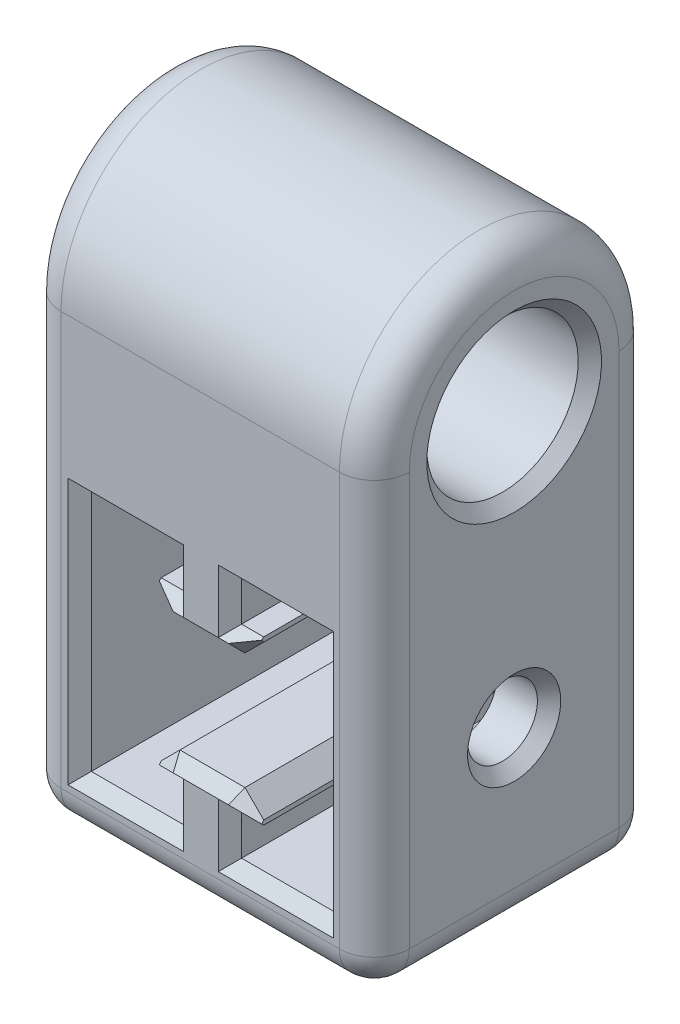
from build123d import *

# Parameters (mm, degrees)
BOSS_EXTRUDE1_DEPTH = 24
SKETCH5_R           = 6.5
BOSS_EXTRUDE3_DEPTH = 29.899298
SKETCH3_R           = 3
CUT_EXTRUDE1_DEPTH  = 53.251488462
SKETCH6_R           = 12
SKETCH6_R_2         = 5
BOSS_EXTRUDE4_DEPTH = 4
FILLET1_R           = 3
CHAMFER1_SIZE       = 1


with BuildPart() as part:
    # Sketch1 → Boss-Extrude1 (new body)
    with BuildSketch(Plane.XY):
        Polygon((0, 15), (14.899298428, 15), (14.899298428, -14.949649214), (-15, -14.949649214), (-15, 15), align=None)
        Polygon((-10.4, 10.4), (-2.5, 10.4), (-2.5, 7), (-4.4, 7), (-4.4, 6.61), (-2.79, 5), (2.79, 5), (4.4, 6.61), (4.4, 7), (2.5, 7), (2.5, 10.4), (10.4, 10.4), (10.4, 2.933567191), (10.4, -2.933567191), (10.4, -10.4), (2.5, -10.4), (2.5, -7), (4.4, -7), (4.4, -6.61), (2.79, -5), (-2.79, -5), (-4.4, -6.61), (-4.4, -7), (-2.5, -7), (-2.5, -10.4), (-10.4, -10.4), (-10.4, -2.933567191), (-10.4, -2.61), (-10.4, 2.933567191), align=None, mode=Mode.SUBTRACT)
    extrude(amount=BOSS_EXTRUDE1_DEPTH)

    # Sketch5 → Boss-Extrude3 (add, through all)
    with BuildSketch(Plane.ZY.offset(15)):
        with BuildLine():
            Line((0, 15), (24, 15))
            Line((24, 15), (24, 23.5))
            ThreePointArc((24, 23.5), (12, 35.5), (0, 23.5))
            Line((0, 23.5), (0, 15))
        make_face()
        with Locations((12, 23.5)):
            Circle(SKETCH5_R, mode=Mode.SUBTRACT)
    extrude(amount=-BOSS_EXTRUDE3_DEPTH)

    # Sketch3 → Cut-Extrude1 (cut, through all)
    with BuildSketch(Plane.ZY.offset(15)):
        with Locations((12, 0)):
            Circle(SKETCH3_R)
    extrude(amount=-CUT_EXTRUDE1_DEPTH, mode=Mode.SUBTRACT)

    # Sketch6 → Boss-Extrude4 (add)
    with BuildSketch(Plane.ZY.offset(15)):
        with Locations((12, 23.5)):
            Circle(SKETCH6_R)
        with Locations((12, 23.5)):
            Circle(SKETCH6_R_2, mode=Mode.SUBTRACT)
    extrude(amount=-BOSS_EXTRUDE4_DEPTH)

    # Fillet1
    fillet1_edges = [part.edges().sort_by_distance(p)[0] for p in [
        (-0.050350786, -14.949649214, 24),
        (14.899298428, 0.025175393, 24),
        (14.899298428, 0.025175393, 0),
        (-0.050350786, -14.949649214, 0),
        (-15, 4.275175393, 0),
        (-15, 4.275175393, 24),
        (14.899298428, -14.949649214, 12),
        (-15, -14.949649214, 12),
        (14.899298, 35.5, 12),
        (-15, 35.5, 12),
    ]]
    fillet(fillet1_edges, radius=FILLET1_R)

    # Chamfer1
    # the kernel refuses this chamfer: 1 mm, written as the material it takes off along each edge
    with BuildSketch(Plane(origin=(-15, 0, 12), x_dir=(0, 0, 1), z_dir=(0, -1, 0))) as chamfer1_piece_1:
        Polygon((3 + CHAMFER1_SIZE, 0), (3, -CHAMFER1_SIZE), (3, 0), align=None)
    revolve(axis=Axis((-15, 0, 12), (-1, 0, 0)), mode=Mode.SUBTRACT)
    with BuildSketch(Plane(origin=(14.899298428, 0, 12), x_dir=(0, 0, 1), z_dir=(0, -1, 0))) as chamfer1_piece_2:
        Polygon((3 + CHAMFER1_SIZE, 0), (3, CHAMFER1_SIZE), (3, 0), align=None)
    revolve(axis=Axis((14.899298428, 0, 12), (-1, 0, 0)), mode=Mode.SUBTRACT)
    with BuildSketch(Plane(origin=(14.899298, 23.5, 12), x_dir=(0, 0, 1), z_dir=(0, -1, 0))) as chamfer1_piece_3:
        Polygon((6.5 + CHAMFER1_SIZE, 0), (6.5, CHAMFER1_SIZE), (6.5, 0), align=None)
    revolve(axis=Axis((14.899298, 23.5, 12), (-1, 0, 0)), mode=Mode.SUBTRACT)
    with BuildSketch(Plane(origin=(-6.21845448, 8.42845448, 0), x_dir=(-0.019442520806012883, -0.01944252080601297, 0.9996219169112968), z_dir=(0.7071067811865491, -0.707106781186546, 0)), Plane(origin=(0.97154552, 3.18154552, 0), x_dir=(0.01944252080601412, -0.019442520806014222, 0.9996219169112968), z_dir=(0.7071067811865493, 0.7071067811865458, 0)), Plane(origin=(6.21845448, -8.42845448, 0), x_dir=(0.019442520806013733, 0.019442520806013854, 0.9996219169112968), z_dir=(-0.7071067811865498, 0.7071067811865452, 0)), Plane(origin=(-0.97154552, -3.18154552, 0), x_dir=(-0.019442520806014107, 0.019442520806014236, 0.9996219169112968), z_dir=(-0.7071067811865498, -0.7071067811865452, 0)), Plane(origin=(-0.97154552, -3.18154552, 24), x_dir=(0.7068394360706712, -0.7068394360706757, 0.02749587661058563), z_dir=(-0.7071067811865498, -0.7071067811865452, 0)), Plane(origin=(6.21845448, -8.42845448, 24), x_dir=(-0.7068394360706712, -0.7068394360706758, 0.027495876610585647), z_dir=(-0.7071067811865498, 0.7071067811865452, 0)), Plane(origin=(0.97154552, 3.18154552, 24), x_dir=(-0.7068394360706717, 0.7068394360706753, 0.02749587661058563), z_dir=(0.7071067811865493, 0.7071067811865458, 0)), Plane(origin=(-6.21845448, 8.42845448, 24), x_dir=(0.706839436070672, 0.706839436070675, 0.02749587661058563), z_dir=(0.7071067811865491, -0.707106781186546, 0))) as chamfer1_piece_4:
        Polygon((CHAMFER1_SIZE * 0.999621916911, -CHAMFER1_SIZE * 0.0274958766106), (-CHAMFER1_SIZE * 0.0274958766106, -CHAMFER1_SIZE * 0.999621916911), (0, 0), align=None)
    extrude(amount=7.420249811, mode=Mode.SUBTRACT)
    with BuildSketch(Plane(origin=(-5.361682988, 5, 0), x_dir=(0, -0.027495876610586494, 0.9996219169112968), z_dir=(1, 0, 0)), Plane(origin=(5.361682988, -5, 0), x_dir=(0, 0.027495876610586494, 0.9996219169112968), z_dir=(-1, 0, 0)), Plane(origin=(5.361682988, -5, 24), x_dir=(0, -0.9996219169112968, 0.027495876610585623), z_dir=(-1, 0, 0)), Plane(origin=(-5.361682988, 5, 24), x_dir=(0, 0.9996219169112968, 0.027495876610585623), z_dir=(1, 0, 0))) as chamfer1_piece_5:
        Polygon((CHAMFER1_SIZE * 0.999621916911, -CHAMFER1_SIZE * 0.0274958766106), (-CHAMFER1_SIZE * 0.0274958766106, -CHAMFER1_SIZE * 0.999621916911), (0, 0), align=None)
    extrude(amount=10.723365976, mode=Mode.SUBTRACT)
    with BuildSketch(Plane(origin=(6.971682988, 7, 0), x_dir=(0, 0.027495876610586494, 0.9996219169112968), z_dir=(-1, 0, 0)), Plane(origin=(2.5, -7, 0), x_dir=(0, -0.027495876610586494, 0.9996219169112968), z_dir=(1, 0, 0)), Plane(origin=(-6.971682988, -7, 0), x_dir=(0, -0.027495876610586494, 0.9996219169112968), z_dir=(1, 0, 0)), Plane(origin=(-2.5, 7, 0), x_dir=(0, 0.027495876610586494, 0.9996219169112968), z_dir=(-1, 0, 0)), Plane(origin=(-6.971682988, -7, 24), x_dir=(1.4018567596735031e-15, 0.9996219169112968, 0.027495876610585623), z_dir=(1, 0, 0)), Plane(origin=(2.5, -7, 24), x_dir=(-1.4018567596735031e-15, 0.9996219169112968, 0.027495876610585623), z_dir=(1, 0, 0)), Plane(origin=(6.971682988, 7, 24), x_dir=(0, -0.9996219169112968, 0.027495876610585623), z_dir=(-1, 0, 0)), Plane(origin=(-2.5, 7, 24), x_dir=(0, -0.9996219169112968, 0.027495876610585623), z_dir=(-1, 0, 0))) as chamfer1_piece_6:
        Polygon((CHAMFER1_SIZE * 0.999621916911, -CHAMFER1_SIZE * 0.0274958766106), (-CHAMFER1_SIZE * 0.0274958766106, -CHAMFER1_SIZE * 0.999621916911), (0, 0), align=None)
    extrude(amount=4.471682988, mode=Mode.SUBTRACT)
    with BuildSketch(Plane(origin=(2.5, 7, 0), x_dir=(0.027495876610586494, 0, 0.9996219169112968), z_dir=(0, 1, 0)), Plane(origin=(2.5, -10.4, 0), x_dir=(0.027495876610586494, 0, 0.9996219169112968), z_dir=(0, 1, 0)), Plane(origin=(-2.5, -7, 0), x_dir=(-0.027495876610586494, 0, 0.9996219169112968), z_dir=(0, -1, 0)), Plane(origin=(-2.5, 10.4, 0), x_dir=(-0.027495876610586494, 0, 0.9996219169112968), z_dir=(0, -1, 0)), Plane(origin=(-2.5, 10.4, 24), x_dir=(0.9996219169112968, 1.5145550481962746e-14, 0.02749587661058563), z_dir=(0, -1, 0)), Plane(origin=(-2.5, -7, 24), x_dir=(0.9996219169112968, 1.488442030123925e-14, 0.02749587661058563), z_dir=(0, -1, 0)), Plane(origin=(2.5, -10.4, 24), x_dir=(-0.9996219169112968, 1.488442030123925e-14, 0.02749587661058563), z_dir=(0, 1, 0)), Plane(origin=(2.5, 7, 24), x_dir=(-0.9996219169112968, -1.5145550481962746e-14, 0.02749587661058563), z_dir=(0, 1, 0))) as chamfer1_piece_7:
        Polygon((CHAMFER1_SIZE * 0.999621916911, -CHAMFER1_SIZE * 0.0274958766106), (-CHAMFER1_SIZE * 0.0274958766106, -CHAMFER1_SIZE * 0.999621916911), (0, 0), align=None)
    extrude(amount=3.4, mode=Mode.SUBTRACT)
    with BuildSketch(Plane(origin=(2.5, 10.4, 0), x_dir=(0, -0.02749587661058563, 0.9996219169112968), z_dir=(1, 0, 0)), Plane(origin=(10.4, -10.4, 0), x_dir=(0, 0.02749587661058563, 0.9996219169112968), z_dir=(-1, 0, 0)), Plane(origin=(-2.5, -10.4, 0), x_dir=(0, 0.02749587661058563, 0.9996219169112968), z_dir=(-1, 0, 0)), Plane(origin=(-10.4, 10.4, 0), x_dir=(0, -0.02749587661058563, 0.9996219169112968), z_dir=(1, 0, 0)), Plane(origin=(-10.4, 10.4, 24), x_dir=(0, 0.9996219169112968, 0.027495876610585647), z_dir=(1, 0, 0)), Plane(origin=(-2.5, -10.4, 24), x_dir=(0, -0.9996219169112968, 0.027495876610585647), z_dir=(-1, 0, 0)), Plane(origin=(10.4, -10.4, 24), x_dir=(0, -0.9996219169112968, 0.027495876610585647), z_dir=(-1, 0, 0)), Plane(origin=(2.5, 10.4, 24), x_dir=(0, 0.9996219169112968, 0.027495876610585647), z_dir=(1, 0, 0))) as chamfer1_piece_8:
        Polygon((CHAMFER1_SIZE * 0.999621916911, -CHAMFER1_SIZE * 0.0274958766106), (-CHAMFER1_SIZE * 0.0274958766106, -CHAMFER1_SIZE * 0.999621916911), (0, 0), align=None)
    extrude(amount=7.9, mode=Mode.SUBTRACT)
    with BuildSketch(Plane(origin=(10.4, 10.4, 0), x_dir=(-0.02749587661058908, 0, 0.9996219169112968), z_dir=(0, -1, 0)), Plane(origin=(-10.4, -10.4, 0), x_dir=(0.027495876610587354, 0, 0.9996219169112968), z_dir=(0, 1, 0))) as chamfer1_piece_9:
        Polygon((CHAMFER1_SIZE * 0.999621916911, -CHAMFER1_SIZE * 0.0274958766106), (-CHAMFER1_SIZE * 0.0274958766106, -CHAMFER1_SIZE * 0.999621916911), (0, 0), align=None)
    extrude(amount=20.8, mode=Mode.SUBTRACT)
    with BuildSketch(Plane(origin=(-10.4, 10.4, 24), x_dir=(-0.9996219169112968, 0, 0.027495876610585647), z_dir=(0, -1, 0)), Plane(origin=(10.4, -10.4, 24), x_dir=(0.9996219169112968, 0, 0.027495876610585647), z_dir=(0, 1, 0))) as chamfer1_piece_10:
        Polygon((CHAMFER1_SIZE * 0.999621916911, CHAMFER1_SIZE * 0.0274958766106), (-CHAMFER1_SIZE * 0.0274958766106, CHAMFER1_SIZE * 0.999621916911), (0, 0), align=None)
    extrude(amount=20.8, mode=Mode.SUBTRACT)
    with BuildSketch(Plane(origin=(-15, 23.5, 12), x_dir=(0, 0, 1), z_dir=(0, -1, 0))) as chamfer1_piece_11:
        Polygon((5 + CHAMFER1_SIZE, 0), (5, -CHAMFER1_SIZE), (5, 0), align=None)
    revolve(axis=Axis((-15, 23.5, 12), (-1, 0, 0)), mode=Mode.SUBTRACT)
    with BuildSketch(Plane(origin=(2.5, 4.428317012, 0), x_dir=(0.027495876610586494, 0, 0.9996219169112968), z_dir=(0, 1, 0))) as chamfer1_piece_12a_section:
        Polygon((CHAMFER1_SIZE * 0.999621916911, -CHAMFER1_SIZE * 0.0274958766106), (-CHAMFER1_SIZE * 0.0274958766106, -CHAMFER1_SIZE * 0.999621916911), (0, 0), align=None)
    chamfer1_piece_12a = extrude(amount=5.971682988, mode=Mode.PRIVATE)
    chamfer1_piece_12a = split(chamfer1_piece_12a, bisect_by=Plane(origin=(2.170206373, 7, 0.329793627), z_dir=(0, -1, 0)), keep=Keep.TOP, mode=Mode.PRIVATE)
    with BuildSketch(Plane(origin=(6.971682988, 7, 0), x_dir=(0, 0.027495876610586494, 0.9996219169112968), z_dir=(-1, 0, 0))) as chamfer1_piece_12b_section:
        Polygon((CHAMFER1_SIZE * 0.999621916911, -CHAMFER1_SIZE * 0.0274958766106), (-CHAMFER1_SIZE * 0.0274958766106, -CHAMFER1_SIZE * 0.999621916911), (0, 0), align=None)
    chamfer1_piece_12b = extrude(amount=7.043365976, mode=Mode.PRIVATE)
    chamfer1_piece_12b = split(chamfer1_piece_12b, bisect_by=Plane(origin=(2.5, 6.670206373, 0.329793627), z_dir=(-1, 0, 0)), keep=Keep.TOP, mode=Mode.PRIVATE)
    chamfer1_piece_12 = chamfer1_piece_12a & chamfer1_piece_12b
    add(chamfer1_piece_12, mode=Mode.SUBTRACT)
    with BuildSketch(Plane(origin=(-0.071682988, 10.4, 0), x_dir=(0, -0.02749587661058563, 0.9996219169112968), z_dir=(1, 0, 0))) as chamfer1_piece_13a_section:
        Polygon((CHAMFER1_SIZE * 0.999621916911, -CHAMFER1_SIZE * 0.0274958766106), (-CHAMFER1_SIZE * 0.0274958766106, -CHAMFER1_SIZE * 0.999621916911), (0, 0), align=None)
    chamfer1_piece_13a = extrude(amount=10.471682988, mode=Mode.PRIVATE)
    chamfer1_piece_13a = split(chamfer1_piece_13a, bisect_by=Plane(origin=(2.5, 10.729793627, 0.329793627), z_dir=(-1, 0, 0)), keep=Keep.TOP, mode=Mode.PRIVATE)
    with BuildSketch(Plane(origin=(2.5, 7, 0), x_dir=(0.027495876610586494, 0, 0.9996219169112968), z_dir=(0, 1, 0))) as chamfer1_piece_13b_section:
        Polygon((CHAMFER1_SIZE * 0.999621916911, -CHAMFER1_SIZE * 0.0274958766106), (-CHAMFER1_SIZE * 0.0274958766106, -CHAMFER1_SIZE * 0.999621916911), (0, 0), align=None)
    chamfer1_piece_13b = extrude(amount=5.971682988, mode=Mode.PRIVATE)
    chamfer1_piece_13b = split(chamfer1_piece_13b, bisect_by=Plane(origin=(2.170206373, 10.4, 0.329793627), z_dir=(0, 1, 0)), keep=Keep.TOP, mode=Mode.PRIVATE)
    chamfer1_piece_13 = chamfer1_piece_13a & chamfer1_piece_13b
    add(chamfer1_piece_13, mode=Mode.SUBTRACT)
    with BuildSketch(Plane(origin=(10.4, 12.971682988, 0), x_dir=(-0.02749587661058563, 0, 0.9996219169112968), z_dir=(0, -1, 0))) as chamfer1_piece_14a_section:
        Polygon((CHAMFER1_SIZE * 0.999621916911, -CHAMFER1_SIZE * 0.0274958766106), (-CHAMFER1_SIZE * 0.0274958766106, -CHAMFER1_SIZE * 0.999621916911), (0, 0), align=None)
    chamfer1_piece_14a = extrude(amount=23.371682988, mode=Mode.PRIVATE)
    chamfer1_piece_14a = split(chamfer1_piece_14a, bisect_by=Plane(origin=(10.729793627, 10.4, 0.329793627), z_dir=(0, 1, 0)), keep=Keep.TOP, mode=Mode.PRIVATE)
    with BuildSketch(Plane(origin=(2.5, 10.4, 0), x_dir=(0, -0.02749587661058563, 0.9996219169112968), z_dir=(1, 0, 0))) as chamfer1_piece_14b_section:
        Polygon((CHAMFER1_SIZE * 0.999621916911, -CHAMFER1_SIZE * 0.0274958766106), (-CHAMFER1_SIZE * 0.0274958766106, -CHAMFER1_SIZE * 0.999621916911), (0, 0), align=None)
    chamfer1_piece_14b = extrude(amount=10.471682988, mode=Mode.PRIVATE)
    chamfer1_piece_14b = split(chamfer1_piece_14b, bisect_by=Plane(origin=(10.4, 10.729793627, 0.329793627), z_dir=(1, 0, 0)), keep=Keep.TOP, mode=Mode.PRIVATE)
    chamfer1_piece_14 = chamfer1_piece_14a & chamfer1_piece_14b
    add(chamfer1_piece_14, mode=Mode.SUBTRACT)
    with BuildSketch(Plane(origin=(12.971682988, -10.4, 0), x_dir=(0, 0.02749587661058563, 0.9996219169112968), z_dir=(-1, 0, 0))) as chamfer1_piece_15a_section:
        Polygon((CHAMFER1_SIZE * 0.999621916911, -CHAMFER1_SIZE * 0.0274958766106), (-CHAMFER1_SIZE * 0.0274958766106, -CHAMFER1_SIZE * 0.999621916911), (0, 0), align=None)
    chamfer1_piece_15a = extrude(amount=10.471682988, mode=Mode.PRIVATE)
    chamfer1_piece_15a = split(chamfer1_piece_15a, bisect_by=Plane(origin=(10.4, -10.729793627, 0.329793627), z_dir=(1, 0, 0)), keep=Keep.TOP, mode=Mode.PRIVATE)
    with BuildSketch(Plane(origin=(10.4, 10.4, 0), x_dir=(-0.02749587661058908, 0, 0.9996219169112968), z_dir=(0, -1, 0))) as chamfer1_piece_15b_section:
        Polygon((CHAMFER1_SIZE * 0.999621916911, -CHAMFER1_SIZE * 0.0274958766106), (-CHAMFER1_SIZE * 0.0274958766106, -CHAMFER1_SIZE * 0.999621916911), (0, 0), align=None)
    chamfer1_piece_15b = extrude(amount=23.371682988, mode=Mode.PRIVATE)
    chamfer1_piece_15b = split(chamfer1_piece_15b, bisect_by=Plane(origin=(10.729793627, -10.4, 0.329793627), z_dir=(0, -1, 0)), keep=Keep.TOP, mode=Mode.PRIVATE)
    chamfer1_piece_15 = chamfer1_piece_15a & chamfer1_piece_15b
    add(chamfer1_piece_15, mode=Mode.SUBTRACT)
    with BuildSketch(Plane(origin=(2.5, -12.971682988, 0), x_dir=(0.027495876610586494, 0, 0.9996219169112968), z_dir=(0, 1, 0))) as chamfer1_piece_16a_section:
        Polygon((CHAMFER1_SIZE * 0.999621916911, -CHAMFER1_SIZE * 0.0274958766106), (-CHAMFER1_SIZE * 0.0274958766106, -CHAMFER1_SIZE * 0.999621916911), (0, 0), align=None)
    chamfer1_piece_16a = extrude(amount=5.971682988, mode=Mode.PRIVATE)
    chamfer1_piece_16a = split(chamfer1_piece_16a, bisect_by=Plane(origin=(2.170206373, -10.4, 0.329793627), z_dir=(0, -1, 0)), keep=Keep.TOP, mode=Mode.PRIVATE)
    with BuildSketch(Plane(origin=(10.4, -10.4, 0), x_dir=(0, 0.02749587661058563, 0.9996219169112968), z_dir=(-1, 0, 0))) as chamfer1_piece_16b_section:
        Polygon((CHAMFER1_SIZE * 0.999621916911, -CHAMFER1_SIZE * 0.0274958766106), (-CHAMFER1_SIZE * 0.0274958766106, -CHAMFER1_SIZE * 0.999621916911), (0, 0), align=None)
    chamfer1_piece_16b = extrude(amount=10.471682988, mode=Mode.PRIVATE)
    chamfer1_piece_16b = split(chamfer1_piece_16b, bisect_by=Plane(origin=(2.5, -10.729793627, 0.329793627), z_dir=(-1, 0, 0)), keep=Keep.TOP, mode=Mode.PRIVATE)
    chamfer1_piece_16 = chamfer1_piece_16a & chamfer1_piece_16b
    add(chamfer1_piece_16, mode=Mode.SUBTRACT)
    with BuildSketch(Plane(origin=(-0.071682988, -7, 0), x_dir=(0, -0.027495876610586494, 0.9996219169112968), z_dir=(1, 0, 0))) as chamfer1_piece_17a_section:
        Polygon((CHAMFER1_SIZE * 0.999621916911, -CHAMFER1_SIZE * 0.0274958766106), (-CHAMFER1_SIZE * 0.0274958766106, -CHAMFER1_SIZE * 0.999621916911), (0, 0), align=None)
    chamfer1_piece_17a = extrude(amount=7.043365976, mode=Mode.PRIVATE)
    chamfer1_piece_17a = split(chamfer1_piece_17a, bisect_by=Plane(origin=(2.5, -6.670206373, 0.329793627), z_dir=(-1, 0, 0)), keep=Keep.TOP, mode=Mode.PRIVATE)
    with BuildSketch(Plane(origin=(2.5, -10.4, 0), x_dir=(0.027495876610586494, 0, 0.9996219169112968), z_dir=(0, 1, 0))) as chamfer1_piece_17b_section:
        Polygon((CHAMFER1_SIZE * 0.999621916911, -CHAMFER1_SIZE * 0.0274958766106), (-CHAMFER1_SIZE * 0.0274958766106, -CHAMFER1_SIZE * 0.999621916911), (0, 0), align=None)
    chamfer1_piece_17b = extrude(amount=5.971682988, mode=Mode.PRIVATE)
    chamfer1_piece_17b = split(chamfer1_piece_17b, bisect_by=Plane(origin=(2.170206373, -7, 0.329793627), z_dir=(0, 1, 0)), keep=Keep.TOP, mode=Mode.PRIVATE)
    chamfer1_piece_17 = chamfer1_piece_17a & chamfer1_piece_17b
    add(chamfer1_piece_17, mode=Mode.SUBTRACT)
    with BuildSketch(Plane(origin=(-2.5, -4.428317012, 0), x_dir=(-0.027495876610586494, 0, 0.9996219169112968), z_dir=(0, -1, 0))) as chamfer1_piece_18a_section:
        Polygon((CHAMFER1_SIZE * 0.999621916911, -CHAMFER1_SIZE * 0.0274958766106), (-CHAMFER1_SIZE * 0.0274958766106, -CHAMFER1_SIZE * 0.999621916911), (0, 0), align=None)
    chamfer1_piece_18a = extrude(amount=5.971682988, mode=Mode.PRIVATE)
    chamfer1_piece_18a = split(chamfer1_piece_18a, bisect_by=Plane(origin=(-2.170206373, -7, 0.329793627), z_dir=(0, 1, 0)), keep=Keep.TOP, mode=Mode.PRIVATE)
    with BuildSketch(Plane(origin=(-6.971682988, -7, 0), x_dir=(0, -0.027495876610586494, 0.9996219169112968), z_dir=(1, 0, 0))) as chamfer1_piece_18b_section:
        Polygon((CHAMFER1_SIZE * 0.999621916911, -CHAMFER1_SIZE * 0.0274958766106), (-CHAMFER1_SIZE * 0.0274958766106, -CHAMFER1_SIZE * 0.999621916911), (0, 0), align=None)
    chamfer1_piece_18b = extrude(amount=7.043365976, mode=Mode.PRIVATE)
    chamfer1_piece_18b = split(chamfer1_piece_18b, bisect_by=Plane(origin=(-2.5, -6.670206373, 0.329793627), z_dir=(1, 0, 0)), keep=Keep.TOP, mode=Mode.PRIVATE)
    chamfer1_piece_18 = chamfer1_piece_18a & chamfer1_piece_18b
    add(chamfer1_piece_18, mode=Mode.SUBTRACT)
    with BuildSketch(Plane(origin=(0.071682988, -10.4, 0), x_dir=(0, 0.02749587661058563, 0.9996219169112968), z_dir=(-1, 0, 0))) as chamfer1_piece_19a_section:
        Polygon((CHAMFER1_SIZE * 0.999621916911, -CHAMFER1_SIZE * 0.0274958766106), (-CHAMFER1_SIZE * 0.0274958766106, -CHAMFER1_SIZE * 0.999621916911), (0, 0), align=None)
    chamfer1_piece_19a = extrude(amount=10.471682988, mode=Mode.PRIVATE)
    chamfer1_piece_19a = split(chamfer1_piece_19a, bisect_by=Plane(origin=(-2.5, -10.729793627, 0.329793627), z_dir=(1, 0, 0)), keep=Keep.TOP, mode=Mode.PRIVATE)
    with BuildSketch(Plane(origin=(-2.5, -7, 0), x_dir=(-0.027495876610586494, 0, 0.9996219169112968), z_dir=(0, -1, 0))) as chamfer1_piece_19b_section:
        Polygon((CHAMFER1_SIZE * 0.999621916911, -CHAMFER1_SIZE * 0.0274958766106), (-CHAMFER1_SIZE * 0.0274958766106, -CHAMFER1_SIZE * 0.999621916911), (0, 0), align=None)
    chamfer1_piece_19b = extrude(amount=5.971682988, mode=Mode.PRIVATE)
    chamfer1_piece_19b = split(chamfer1_piece_19b, bisect_by=Plane(origin=(-2.170206373, -10.4, 0.329793627), z_dir=(0, -1, 0)), keep=Keep.TOP, mode=Mode.PRIVATE)
    chamfer1_piece_19 = chamfer1_piece_19a & chamfer1_piece_19b
    add(chamfer1_piece_19, mode=Mode.SUBTRACT)
    with BuildSketch(Plane(origin=(-10.4, -12.971682988, 0), x_dir=(0.02749587661058563, 0, 0.9996219169112968), z_dir=(0, 1, 0))) as chamfer1_piece_20a_section:
        Polygon((CHAMFER1_SIZE * 0.999621916911, -CHAMFER1_SIZE * 0.0274958766106), (-CHAMFER1_SIZE * 0.0274958766106, -CHAMFER1_SIZE * 0.999621916911), (0, 0), align=None)
    chamfer1_piece_20a = extrude(amount=23.371682988, mode=Mode.PRIVATE)
    chamfer1_piece_20a = split(chamfer1_piece_20a, bisect_by=Plane(origin=(-10.729793627, -10.4, 0.329793627), z_dir=(0, -1, 0)), keep=Keep.TOP, mode=Mode.PRIVATE)
    with BuildSketch(Plane(origin=(-2.5, -10.4, 0), x_dir=(0, 0.02749587661058563, 0.9996219169112968), z_dir=(-1, 0, 0))) as chamfer1_piece_20b_section:
        Polygon((CHAMFER1_SIZE * 0.999621916911, -CHAMFER1_SIZE * 0.0274958766106), (-CHAMFER1_SIZE * 0.0274958766106, -CHAMFER1_SIZE * 0.999621916911), (0, 0), align=None)
    chamfer1_piece_20b = extrude(amount=10.471682988, mode=Mode.PRIVATE)
    chamfer1_piece_20b = split(chamfer1_piece_20b, bisect_by=Plane(origin=(-10.4, -10.729793627, 0.329793627), z_dir=(-1, 0, 0)), keep=Keep.TOP, mode=Mode.PRIVATE)
    chamfer1_piece_20 = chamfer1_piece_20a & chamfer1_piece_20b
    add(chamfer1_piece_20, mode=Mode.SUBTRACT)
    with BuildSketch(Plane(origin=(-10.4, -10.4, 0), x_dir=(0.027495876610587354, 0, 0.9996219169112968), z_dir=(0, 1, 0))) as chamfer1_piece_21a_section:
        Polygon((CHAMFER1_SIZE * 0.999621916911, -CHAMFER1_SIZE * 0.0274958766106), (-CHAMFER1_SIZE * 0.0274958766106, -CHAMFER1_SIZE * 0.999621916911), (0, 0), align=None)
    chamfer1_piece_21a = extrude(amount=23.371682988, mode=Mode.PRIVATE)
    chamfer1_piece_21a = split(chamfer1_piece_21a, bisect_by=Plane(origin=(-10.729793627, 10.4, 0.329793627), z_dir=(0, 1, 0)), keep=Keep.TOP, mode=Mode.PRIVATE)
    with BuildSketch(Plane(origin=(-12.971682988, 10.4, 0), x_dir=(0, -0.02749587661058563, 0.9996219169112968), z_dir=(1, 0, 0))) as chamfer1_piece_21b_section:
        Polygon((CHAMFER1_SIZE * 0.999621916911, -CHAMFER1_SIZE * 0.0274958766106), (-CHAMFER1_SIZE * 0.0274958766106, -CHAMFER1_SIZE * 0.999621916911), (0, 0), align=None)
    chamfer1_piece_21b = extrude(amount=10.471682988, mode=Mode.PRIVATE)
    chamfer1_piece_21b = split(chamfer1_piece_21b, bisect_by=Plane(origin=(-10.4, 10.729793627, 0.329793627), z_dir=(-1, 0, 0)), keep=Keep.TOP, mode=Mode.PRIVATE)
    chamfer1_piece_21 = chamfer1_piece_21a & chamfer1_piece_21b
    add(chamfer1_piece_21, mode=Mode.SUBTRACT)
    with BuildSketch(Plane(origin=(-2.5, 12.971682988, 0), x_dir=(-0.027495876610586494, 0, 0.9996219169112968), z_dir=(0, -1, 0))) as chamfer1_piece_22a_section:
        Polygon((CHAMFER1_SIZE * 0.999621916911, -CHAMFER1_SIZE * 0.0274958766106), (-CHAMFER1_SIZE * 0.0274958766106, -CHAMFER1_SIZE * 0.999621916911), (0, 0), align=None)
    chamfer1_piece_22a = extrude(amount=5.971682988, mode=Mode.PRIVATE)
    chamfer1_piece_22a = split(chamfer1_piece_22a, bisect_by=Plane(origin=(-2.170206373, 10.4, 0.329793627), z_dir=(0, 1, 0)), keep=Keep.TOP, mode=Mode.PRIVATE)
    with BuildSketch(Plane(origin=(-10.4, 10.4, 0), x_dir=(0, -0.02749587661058563, 0.9996219169112968), z_dir=(1, 0, 0))) as chamfer1_piece_22b_section:
        Polygon((CHAMFER1_SIZE * 0.999621916911, -CHAMFER1_SIZE * 0.0274958766106), (-CHAMFER1_SIZE * 0.0274958766106, -CHAMFER1_SIZE * 0.999621916911), (0, 0), align=None)
    chamfer1_piece_22b = extrude(amount=10.471682988, mode=Mode.PRIVATE)
    chamfer1_piece_22b = split(chamfer1_piece_22b, bisect_by=Plane(origin=(-2.5, 10.729793627, 0.329793627), z_dir=(1, 0, 0)), keep=Keep.TOP, mode=Mode.PRIVATE)
    chamfer1_piece_22 = chamfer1_piece_22a & chamfer1_piece_22b
    add(chamfer1_piece_22, mode=Mode.SUBTRACT)
    with BuildSketch(Plane(origin=(0.071682988, 7, 0), x_dir=(0, 0.027495876610586494, 0.9996219169112968), z_dir=(-1, 0, 0))) as chamfer1_piece_23a_section:
        Polygon((CHAMFER1_SIZE * 0.999621916911, -CHAMFER1_SIZE * 0.0274958766106), (-CHAMFER1_SIZE * 0.0274958766106, -CHAMFER1_SIZE * 0.999621916911), (0, 0), align=None)
    chamfer1_piece_23a = extrude(amount=7.043365976, mode=Mode.PRIVATE)
    chamfer1_piece_23a = split(chamfer1_piece_23a, bisect_by=Plane(origin=(-2.5, 6.670206373, 0.329793627), z_dir=(1, 0, 0)), keep=Keep.TOP, mode=Mode.PRIVATE)
    with BuildSketch(Plane(origin=(-2.5, 10.4, 0), x_dir=(-0.027495876610586494, 0, 0.9996219169112968), z_dir=(0, -1, 0))) as chamfer1_piece_23b_section:
        Polygon((CHAMFER1_SIZE * 0.999621916911, -CHAMFER1_SIZE * 0.0274958766106), (-CHAMFER1_SIZE * 0.0274958766106, -CHAMFER1_SIZE * 0.999621916911), (0, 0), align=None)
    chamfer1_piece_23b = extrude(amount=5.971682988, mode=Mode.PRIVATE)
    chamfer1_piece_23b = split(chamfer1_piece_23b, bisect_by=Plane(origin=(-2.170206373, 7, 0.329793627), z_dir=(0, -1, 0)), keep=Keep.TOP, mode=Mode.PRIVATE)
    chamfer1_piece_23 = chamfer1_piece_23a & chamfer1_piece_23b
    add(chamfer1_piece_23, mode=Mode.SUBTRACT)
    with BuildSketch(Plane(origin=(-2.5, 12.971682988, 24), x_dir=(0.9996219169112968, 1.5145550481962746e-14, 0.02749587661058563), z_dir=(0, -1, 0))) as chamfer1_piece_24a_section:
        Polygon((CHAMFER1_SIZE * 0.999621916911, -CHAMFER1_SIZE * 0.0274958766106), (-CHAMFER1_SIZE * 0.0274958766106, -CHAMFER1_SIZE * 0.999621916911), (0, 0), align=None)
    chamfer1_piece_24a = extrude(amount=5.971682988, mode=Mode.PRIVATE)
    chamfer1_piece_24a = split(chamfer1_piece_24a, bisect_by=Plane(origin=(-2.170206373, 10.4, 23.670206373), z_dir=(0, 1, 0)), keep=Keep.TOP, mode=Mode.PRIVATE)
    with BuildSketch(Plane(origin=(-10.4, 10.4, 24), x_dir=(0, 0.9996219169112968, 0.027495876610585647), z_dir=(1, 0, 0))) as chamfer1_piece_24b_section:
        Polygon((CHAMFER1_SIZE * 0.999621916911, -CHAMFER1_SIZE * 0.0274958766106), (-CHAMFER1_SIZE * 0.0274958766106, -CHAMFER1_SIZE * 0.999621916911), (0, 0), align=None)
    chamfer1_piece_24b = extrude(amount=10.471682988, mode=Mode.PRIVATE)
    chamfer1_piece_24b = split(chamfer1_piece_24b, bisect_by=Plane(origin=(-2.5, 10.729793627, 23.670206373), z_dir=(1, 0, 0)), keep=Keep.TOP, mode=Mode.PRIVATE)
    chamfer1_piece_24 = chamfer1_piece_24a & chamfer1_piece_24b
    add(chamfer1_piece_24, mode=Mode.SUBTRACT)
    with BuildSketch(Plane(origin=(0.071682988, 7, 24), x_dir=(0, -0.9996219169112968, 0.027495876610585623), z_dir=(-1, 0, 0))) as chamfer1_piece_25a_section:
        Polygon((CHAMFER1_SIZE * 0.999621916911, -CHAMFER1_SIZE * 0.0274958766106), (-CHAMFER1_SIZE * 0.0274958766106, -CHAMFER1_SIZE * 0.999621916911), (0, 0), align=None)
    chamfer1_piece_25a = extrude(amount=7.043365976, mode=Mode.PRIVATE)
    chamfer1_piece_25a = split(chamfer1_piece_25a, bisect_by=Plane(origin=(-2.5, 6.670206373, 23.670206373), z_dir=(1, 0, 0)), keep=Keep.TOP, mode=Mode.PRIVATE)
    with BuildSketch(Plane(origin=(-2.5, 10.4, 24), x_dir=(0.9996219169112968, 1.5145550481962746e-14, 0.02749587661058563), z_dir=(0, -1, 0))) as chamfer1_piece_25b_section:
        Polygon((CHAMFER1_SIZE * 0.999621916911, -CHAMFER1_SIZE * 0.0274958766106), (-CHAMFER1_SIZE * 0.0274958766106, -CHAMFER1_SIZE * 0.999621916911), (0, 0), align=None)
    chamfer1_piece_25b = extrude(amount=5.971682988, mode=Mode.PRIVATE)
    chamfer1_piece_25b = split(chamfer1_piece_25b, bisect_by=Plane(origin=(-2.170206373, 7, 23.670206373), z_dir=(0, -1, 0)), keep=Keep.TOP, mode=Mode.PRIVATE)
    chamfer1_piece_25 = chamfer1_piece_25a & chamfer1_piece_25b
    add(chamfer1_piece_25, mode=Mode.SUBTRACT)
    with BuildSketch(Plane(origin=(-10.4, 12.971682988, 24), x_dir=(-0.9996219169112968, 0, 0.027495876610585647), z_dir=(0, -1, 0))) as chamfer1_piece_26a_section:
        Polygon((CHAMFER1_SIZE * 0.999621916911, CHAMFER1_SIZE * 0.0274958766106), (-CHAMFER1_SIZE * 0.0274958766106, CHAMFER1_SIZE * 0.999621916911), (0, 0), align=None)
    chamfer1_piece_26a = extrude(amount=23.371682988, mode=Mode.PRIVATE)
    chamfer1_piece_26a = split(chamfer1_piece_26a, bisect_by=Plane(origin=(-10.729793627, 10.4, 23.670206373), z_dir=(0, 1, 0)), keep=Keep.TOP, mode=Mode.PRIVATE)
    with BuildSketch(Plane(origin=(-12.971682988, 10.4, 24), x_dir=(0, 0.9996219169112968, 0.027495876610585647), z_dir=(1, 0, 0))) as chamfer1_piece_26b_section:
        Polygon((CHAMFER1_SIZE * 0.999621916911, -CHAMFER1_SIZE * 0.0274958766106), (-CHAMFER1_SIZE * 0.0274958766106, -CHAMFER1_SIZE * 0.999621916911), (0, 0), align=None)
    chamfer1_piece_26b = extrude(amount=10.471682988, mode=Mode.PRIVATE)
    chamfer1_piece_26b = split(chamfer1_piece_26b, bisect_by=Plane(origin=(-10.4, 10.729793627, 23.670206373), z_dir=(-1, 0, 0)), keep=Keep.TOP, mode=Mode.PRIVATE)
    chamfer1_piece_26 = chamfer1_piece_26a & chamfer1_piece_26b
    add(chamfer1_piece_26, mode=Mode.SUBTRACT)
    with BuildSketch(Plane(origin=(-10.4, 10.4, 24), x_dir=(-0.9996219169112968, 0, 0.027495876610585647), z_dir=(0, -1, 0))) as chamfer1_piece_27a_section:
        Polygon((CHAMFER1_SIZE * 0.999621916911, CHAMFER1_SIZE * 0.0274958766106), (-CHAMFER1_SIZE * 0.0274958766106, CHAMFER1_SIZE * 0.999621916911), (0, 0), align=None)
    chamfer1_piece_27a = extrude(amount=23.371682988, mode=Mode.PRIVATE)
    chamfer1_piece_27a = split(chamfer1_piece_27a, bisect_by=Plane(origin=(-10.729793627, -10.4, 23.670206373), z_dir=(0, -1, 0)), keep=Keep.TOP, mode=Mode.PRIVATE)
    with BuildSketch(Plane(origin=(-2.5, -10.4, 24), x_dir=(0, -0.9996219169112968, 0.027495876610585647), z_dir=(-1, 0, 0))) as chamfer1_piece_27b_section:
        Polygon((CHAMFER1_SIZE * 0.999621916911, -CHAMFER1_SIZE * 0.0274958766106), (-CHAMFER1_SIZE * 0.0274958766106, -CHAMFER1_SIZE * 0.999621916911), (0, 0), align=None)
    chamfer1_piece_27b = extrude(amount=10.471682988, mode=Mode.PRIVATE)
    chamfer1_piece_27b = split(chamfer1_piece_27b, bisect_by=Plane(origin=(-10.4, -10.729793627, 23.670206373), z_dir=(-1, 0, 0)), keep=Keep.TOP, mode=Mode.PRIVATE)
    chamfer1_piece_27 = chamfer1_piece_27a & chamfer1_piece_27b
    add(chamfer1_piece_27, mode=Mode.SUBTRACT)
    with BuildSketch(Plane(origin=(0.071682988, -10.4, 24), x_dir=(0, -0.9996219169112968, 0.027495876610585647), z_dir=(-1, 0, 0))) as chamfer1_piece_28a_section:
        Polygon((CHAMFER1_SIZE * 0.999621916911, -CHAMFER1_SIZE * 0.0274958766106), (-CHAMFER1_SIZE * 0.0274958766106, -CHAMFER1_SIZE * 0.999621916911), (0, 0), align=None)
    chamfer1_piece_28a = extrude(amount=10.471682988, mode=Mode.PRIVATE)
    chamfer1_piece_28a = split(chamfer1_piece_28a, bisect_by=Plane(origin=(-2.5, -10.729793627, 23.670206373), z_dir=(1, 0, 0)), keep=Keep.TOP, mode=Mode.PRIVATE)
    with BuildSketch(Plane(origin=(-2.5, -7, 24), x_dir=(0.9996219169112968, 1.488442030123925e-14, 0.02749587661058563), z_dir=(0, -1, 0))) as chamfer1_piece_28b_section:
        Polygon((CHAMFER1_SIZE * 0.999621916911, -CHAMFER1_SIZE * 0.0274958766106), (-CHAMFER1_SIZE * 0.0274958766106, -CHAMFER1_SIZE * 0.999621916911), (0, 0), align=None)
    chamfer1_piece_28b = extrude(amount=5.971682988, mode=Mode.PRIVATE)
    chamfer1_piece_28b = split(chamfer1_piece_28b, bisect_by=Plane(origin=(-2.170206373, -10.4, 23.670206373), z_dir=(0, -1, 0)), keep=Keep.TOP, mode=Mode.PRIVATE)
    chamfer1_piece_28 = chamfer1_piece_28a & chamfer1_piece_28b
    add(chamfer1_piece_28, mode=Mode.SUBTRACT)
    with BuildSketch(Plane(origin=(-2.5, -4.428317012, 24), x_dir=(0.9996219169112968, 1.488442030123925e-14, 0.02749587661058563), z_dir=(0, -1, 0))) as chamfer1_piece_29a_section:
        Polygon((CHAMFER1_SIZE * 0.999621916911, -CHAMFER1_SIZE * 0.0274958766106), (-CHAMFER1_SIZE * 0.0274958766106, -CHAMFER1_SIZE * 0.999621916911), (0, 0), align=None)
    chamfer1_piece_29a = extrude(amount=5.971682988, mode=Mode.PRIVATE)
    chamfer1_piece_29a = split(chamfer1_piece_29a, bisect_by=Plane(origin=(-2.170206373, -7, 23.670206373), z_dir=(0, 1, 0)), keep=Keep.TOP, mode=Mode.PRIVATE)
    with BuildSketch(Plane(origin=(-6.971682988, -7, 24), x_dir=(1.4018567596735031e-15, 0.9996219169112968, 0.027495876610585623), z_dir=(1, 0, 0))) as chamfer1_piece_29b_section:
        Polygon((CHAMFER1_SIZE * 0.999621916911, -CHAMFER1_SIZE * 0.0274958766106), (-CHAMFER1_SIZE * 0.0274958766106, -CHAMFER1_SIZE * 0.999621916911), (0, 0), align=None)
    chamfer1_piece_29b = extrude(amount=7.043365976, mode=Mode.PRIVATE)
    chamfer1_piece_29b = split(chamfer1_piece_29b, bisect_by=Plane(origin=(-2.5, -6.670206373, 23.670206373), z_dir=(1, 0, 0)), keep=Keep.TOP, mode=Mode.PRIVATE)
    chamfer1_piece_29 = chamfer1_piece_29a & chamfer1_piece_29b
    add(chamfer1_piece_29, mode=Mode.SUBTRACT)
    with BuildSketch(Plane(origin=(-0.071682988, -7, 24), x_dir=(-1.4018567596735031e-15, 0.9996219169112968, 0.027495876610585623), z_dir=(1, 0, 0))) as chamfer1_piece_30a_section:
        Polygon((CHAMFER1_SIZE * 0.999621916911, -CHAMFER1_SIZE * 0.0274958766106), (-CHAMFER1_SIZE * 0.0274958766106, -CHAMFER1_SIZE * 0.999621916911), (0, 0), align=None)
    chamfer1_piece_30a = extrude(amount=7.043365976, mode=Mode.PRIVATE)
    chamfer1_piece_30a = split(chamfer1_piece_30a, bisect_by=Plane(origin=(2.5, -6.670206373, 23.670206373), z_dir=(-1, 0, 0)), keep=Keep.TOP, mode=Mode.PRIVATE)
    with BuildSketch(Plane(origin=(2.5, -10.4, 24), x_dir=(-0.9996219169112968, 1.488442030123925e-14, 0.02749587661058563), z_dir=(0, 1, 0))) as chamfer1_piece_30b_section:
        Polygon((CHAMFER1_SIZE * 0.999621916911, -CHAMFER1_SIZE * 0.0274958766106), (-CHAMFER1_SIZE * 0.0274958766106, -CHAMFER1_SIZE * 0.999621916911), (0, 0), align=None)
    chamfer1_piece_30b = extrude(amount=5.971682988, mode=Mode.PRIVATE)
    chamfer1_piece_30b = split(chamfer1_piece_30b, bisect_by=Plane(origin=(2.170206373, -7, 23.670206373), z_dir=(0, 1, 0)), keep=Keep.TOP, mode=Mode.PRIVATE)
    chamfer1_piece_30 = chamfer1_piece_30a & chamfer1_piece_30b
    add(chamfer1_piece_30, mode=Mode.SUBTRACT)
    with BuildSketch(Plane(origin=(2.5, -12.971682988, 24), x_dir=(-0.9996219169112968, 1.488442030123925e-14, 0.02749587661058563), z_dir=(0, 1, 0))) as chamfer1_piece_31a_section:
        Polygon((CHAMFER1_SIZE * 0.999621916911, -CHAMFER1_SIZE * 0.0274958766106), (-CHAMFER1_SIZE * 0.0274958766106, -CHAMFER1_SIZE * 0.999621916911), (0, 0), align=None)
    chamfer1_piece_31a = extrude(amount=5.971682988, mode=Mode.PRIVATE)
    chamfer1_piece_31a = split(chamfer1_piece_31a, bisect_by=Plane(origin=(2.170206373, -10.4, 23.670206373), z_dir=(0, -1, 0)), keep=Keep.TOP, mode=Mode.PRIVATE)
    with BuildSketch(Plane(origin=(10.4, -10.4, 24), x_dir=(0, -0.9996219169112968, 0.027495876610585647), z_dir=(-1, 0, 0))) as chamfer1_piece_31b_section:
        Polygon((CHAMFER1_SIZE * 0.999621916911, -CHAMFER1_SIZE * 0.0274958766106), (-CHAMFER1_SIZE * 0.0274958766106, -CHAMFER1_SIZE * 0.999621916911), (0, 0), align=None)
    chamfer1_piece_31b = extrude(amount=10.471682988, mode=Mode.PRIVATE)
    chamfer1_piece_31b = split(chamfer1_piece_31b, bisect_by=Plane(origin=(2.5, -10.729793627, 23.670206373), z_dir=(-1, 0, 0)), keep=Keep.TOP, mode=Mode.PRIVATE)
    chamfer1_piece_31 = chamfer1_piece_31a & chamfer1_piece_31b
    add(chamfer1_piece_31, mode=Mode.SUBTRACT)
    with BuildSketch(Plane(origin=(12.971682988, -10.4, 24), x_dir=(0, -0.9996219169112968, 0.027495876610585647), z_dir=(-1, 0, 0))) as chamfer1_piece_32a_section:
        Polygon((CHAMFER1_SIZE * 0.999621916911, -CHAMFER1_SIZE * 0.0274958766106), (-CHAMFER1_SIZE * 0.0274958766106, -CHAMFER1_SIZE * 0.999621916911), (0, 0), align=None)
    chamfer1_piece_32a = extrude(amount=10.471682988, mode=Mode.PRIVATE)
    chamfer1_piece_32a = split(chamfer1_piece_32a, bisect_by=Plane(origin=(10.4, -10.729793627, 23.670206373), z_dir=(1, 0, 0)), keep=Keep.TOP, mode=Mode.PRIVATE)
    with BuildSketch(Plane(origin=(10.4, -12.971682988, 24), x_dir=(0.9996219169112968, 0, 0.027495876610585647), z_dir=(0, 1, 0))) as chamfer1_piece_32b_section:
        Polygon((CHAMFER1_SIZE * 0.999621916911, CHAMFER1_SIZE * 0.0274958766106), (-CHAMFER1_SIZE * 0.0274958766106, CHAMFER1_SIZE * 0.999621916911), (0, 0), align=None)
    chamfer1_piece_32b = extrude(amount=23.371682988, mode=Mode.PRIVATE)
    chamfer1_piece_32b = split(chamfer1_piece_32b, bisect_by=Plane(origin=(10.729793627, -10.4, 23.670206373), z_dir=(0, -1, 0)), keep=Keep.TOP, mode=Mode.PRIVATE)
    chamfer1_piece_32 = chamfer1_piece_32a & chamfer1_piece_32b
    add(chamfer1_piece_32, mode=Mode.SUBTRACT)
    with BuildSketch(Plane(origin=(10.4, -10.4, 24), x_dir=(0.9996219169112968, 0, 0.027495876610585647), z_dir=(0, 1, 0))) as chamfer1_piece_33a_section:
        Polygon((CHAMFER1_SIZE * 0.999621916911, CHAMFER1_SIZE * 0.0274958766106), (-CHAMFER1_SIZE * 0.0274958766106, CHAMFER1_SIZE * 0.999621916911), (0, 0), align=None)
    chamfer1_piece_33a = extrude(amount=23.371682988, mode=Mode.PRIVATE)
    chamfer1_piece_33a = split(chamfer1_piece_33a, bisect_by=Plane(origin=(10.729793627, 10.4, 23.670206373), z_dir=(0, 1, 0)), keep=Keep.TOP, mode=Mode.PRIVATE)
    with BuildSketch(Plane(origin=(2.5, 10.4, 24), x_dir=(0, 0.9996219169112968, 0.027495876610585647), z_dir=(1, 0, 0))) as chamfer1_piece_33b_section:
        Polygon((CHAMFER1_SIZE * 0.999621916911, -CHAMFER1_SIZE * 0.0274958766106), (-CHAMFER1_SIZE * 0.0274958766106, -CHAMFER1_SIZE * 0.999621916911), (0, 0), align=None)
    chamfer1_piece_33b = extrude(amount=10.471682988, mode=Mode.PRIVATE)
    chamfer1_piece_33b = split(chamfer1_piece_33b, bisect_by=Plane(origin=(10.4, 10.729793627, 23.670206373), z_dir=(1, 0, 0)), keep=Keep.TOP, mode=Mode.PRIVATE)
    chamfer1_piece_33 = chamfer1_piece_33a & chamfer1_piece_33b
    add(chamfer1_piece_33, mode=Mode.SUBTRACT)
    with BuildSketch(Plane(origin=(-0.071682988, 10.4, 24), x_dir=(0, 0.9996219169112968, 0.027495876610585647), z_dir=(1, 0, 0))) as chamfer1_piece_34a_section:
        Polygon((CHAMFER1_SIZE * 0.999621916911, -CHAMFER1_SIZE * 0.0274958766106), (-CHAMFER1_SIZE * 0.0274958766106, -CHAMFER1_SIZE * 0.999621916911), (0, 0), align=None)
    chamfer1_piece_34a = extrude(amount=10.471682988, mode=Mode.PRIVATE)
    chamfer1_piece_34a = split(chamfer1_piece_34a, bisect_by=Plane(origin=(2.5, 10.729793627, 23.670206373), z_dir=(-1, 0, 0)), keep=Keep.TOP, mode=Mode.PRIVATE)
    with BuildSketch(Plane(origin=(2.5, 7, 24), x_dir=(-0.9996219169112968, -1.5145550481962746e-14, 0.02749587661058563), z_dir=(0, 1, 0))) as chamfer1_piece_34b_section:
        Polygon((CHAMFER1_SIZE * 0.999621916911, -CHAMFER1_SIZE * 0.0274958766106), (-CHAMFER1_SIZE * 0.0274958766106, -CHAMFER1_SIZE * 0.999621916911), (0, 0), align=None)
    chamfer1_piece_34b = extrude(amount=5.971682988, mode=Mode.PRIVATE)
    chamfer1_piece_34b = split(chamfer1_piece_34b, bisect_by=Plane(origin=(2.170206373, 10.4, 23.670206373), z_dir=(0, 1, 0)), keep=Keep.TOP, mode=Mode.PRIVATE)
    chamfer1_piece_34 = chamfer1_piece_34a & chamfer1_piece_34b
    add(chamfer1_piece_34, mode=Mode.SUBTRACT)
    with BuildSketch(Plane(origin=(2.5, 4.428317012, 24), x_dir=(-0.9996219169112968, -1.5145550481962746e-14, 0.02749587661058563), z_dir=(0, 1, 0))) as chamfer1_piece_35a_section:
        Polygon((CHAMFER1_SIZE * 0.999621916911, -CHAMFER1_SIZE * 0.0274958766106), (-CHAMFER1_SIZE * 0.0274958766106, -CHAMFER1_SIZE * 0.999621916911), (0, 0), align=None)
    chamfer1_piece_35a = extrude(amount=5.971682988, mode=Mode.PRIVATE)
    chamfer1_piece_35a = split(chamfer1_piece_35a, bisect_by=Plane(origin=(2.170206373, 7, 23.670206373), z_dir=(0, -1, 0)), keep=Keep.TOP, mode=Mode.PRIVATE)
    with BuildSketch(Plane(origin=(6.971682988, 7, 24), x_dir=(0, -0.9996219169112968, 0.027495876610585623), z_dir=(-1, 0, 0))) as chamfer1_piece_35b_section:
        Polygon((CHAMFER1_SIZE * 0.999621916911, -CHAMFER1_SIZE * 0.0274958766106), (-CHAMFER1_SIZE * 0.0274958766106, -CHAMFER1_SIZE * 0.999621916911), (0, 0), align=None)
    chamfer1_piece_35b = extrude(amount=7.043365976, mode=Mode.PRIVATE)
    chamfer1_piece_35b = split(chamfer1_piece_35b, bisect_by=Plane(origin=(2.5, 6.670206373, 23.670206373), z_dir=(-1, 0, 0)), keep=Keep.TOP, mode=Mode.PRIVATE)
    chamfer1_piece_35 = chamfer1_piece_35a & chamfer1_piece_35b
    add(chamfer1_piece_35, mode=Mode.SUBTRACT)


solid = part.part
